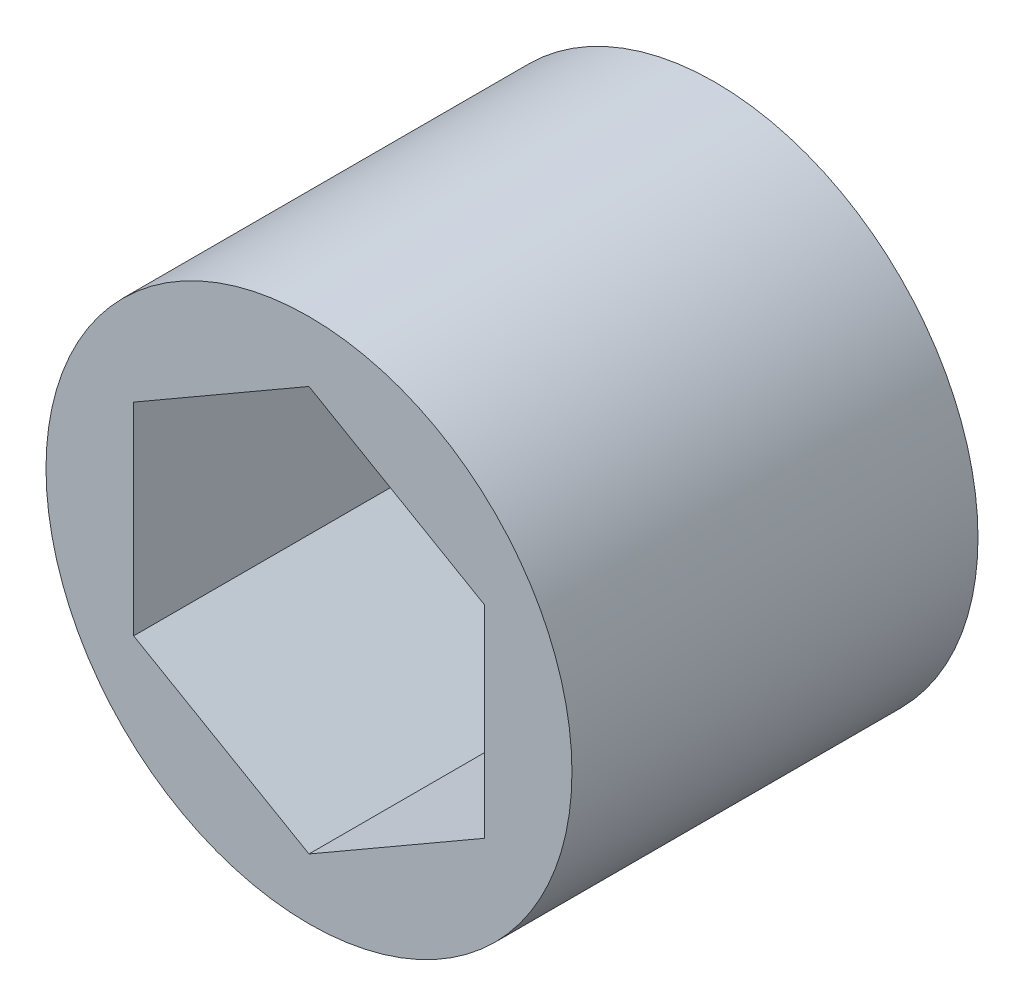
from build123d import *

# Parameters (mm, degrees)
SKETCH1_R           = 9.525
BOSS_EXTRUDE1_DEPTH = 7.3533


with BuildPart() as part:
    # Sketch1 → Boss-Extrude1 (new, symmetric)
    with BuildSketch(Plane.XY):
        Circle(SKETCH1_R)
        Polygon((0, 7.332348419), (-6.35, 3.666174209), (-6.35, -3.666174209), (0, -7.332348419), (6.35, -3.666174209), (6.35, 3.666174209), align=None, mode=Mode.SUBTRACT)
    extrude(amount=BOSS_EXTRUDE1_DEPTH, both=True)


solid = part.part
